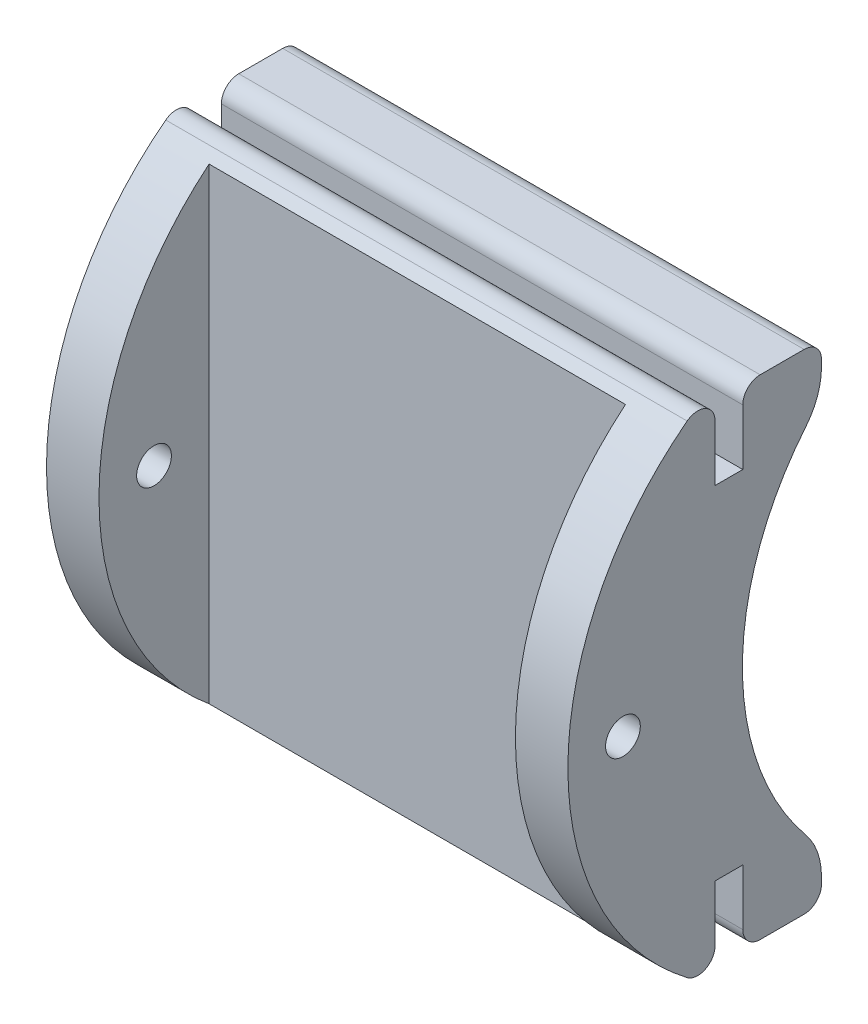
from build123d import *

# Parameters (mm, degrees)
SKETCH2_R               = 5
BOSS_EXTRUDE1_DEPTH     = 150
CUT_EXTRUDE1_DEPTH      = 174.123320195
CUT_EXTRUDE1_DEPTH_BACK = 174.123320195
SKETCH3_W               = 119.804939054
SKETCH3_H               = 31.663894175


with BuildPart() as part:
    # Sketch2 → Boss-Extrude1 (new body)
    with BuildSketch(Plane.YZ):
        with BuildLine():
            Line((-63.5, -22.748786417), (-65.362929888, -22.748786417))
            ThreePointArc((-65.362929888, -22.748786417), (-68.898463793, -21.284320323), (-70.362929888, -17.748786417))
            Line((-70.362929888, -17.748786417), (-70.362929888, -5.101821569))
            ThreePointArc((-70.362929888, -5.101821569), (-68.898463793, -1.566287663), (-65.362929888, -0.101821569))
            Line((-65.362929888, -0.101821569), (-49.260046689, -0.101821569))
            Line((-49.260046689, -0.101821569), (-49.260046689, 7.86536138))
            Line((-49.260046689, 7.86536138), (-65.362929888, 7.86536138))
            ThreePointArc((-65.362929888, 7.86536138), (-69.844346881, 10.647952592), (-69.337783257, 15.898600687))
            ThreePointArc((-69.337783257, 15.898600687), (0, 50.206992469), (69.337783257, 15.898600687))
            ThreePointArc((69.337783257, 15.898600687), (69.844346881, 10.647952592), (65.362929888, 7.86536138))
            Line((65.362929888, 7.86536138), (49.260046689, 7.86536138))
            Line((49.260046689, 7.86536138), (49.260046689, -0.101821569))
            Line((49.260046689, -0.101821569), (65.362929888, -0.101821569))
            ThreePointArc((65.362929888, -0.101821569), (68.898463793, -1.566287663), (70.362929888, -5.101821569))
            Line((70.362929888, -5.101821569), (70.362929888, -17.748786417))
            ThreePointArc((70.362929888, -17.748786417), (68.898463793, -21.284320323), (65.362929888, -22.748786417))
            Line((65.362929888, -22.748786417), (63.5, -22.748786417))
            ThreePointArc((63.5, -22.748786417), (56.754811134, -21.577021257), (50.8, -18.199029134))
            ThreePointArc((50.8, -18.199029134), (0, 0), (-50.8, -18.199029134))
            ThreePointArc((-50.8, -18.199029134), (-56.754811134, -21.577021257), (-63.5, -22.748786417))
        make_face()
        with Locations((0, 34.375045382)):
            Circle(SKETCH2_R, mode=Mode.SUBTRACT)
    extrude(amount=BOSS_EXTRUDE1_DEPTH)

    # Sketch3 → Cut-Extrude1 (cut, two sides: drawn at the far end of the back side and taken through both)
    with BuildSketch(Plane(origin=(0, 0, 0), x_dir=(-1, 0, 0), z_dir=(0, 1, 0)).offset(-CUT_EXTRUDE1_DEPTH_BACK)):
        with Locations((-75, 34.375045382)):
            Rectangle(SKETCH3_W, SKETCH3_H)
    extrude(amount=CUT_EXTRUDE1_DEPTH + CUT_EXTRUDE1_DEPTH_BACK, mode=Mode.SUBTRACT)


solid = part.part
